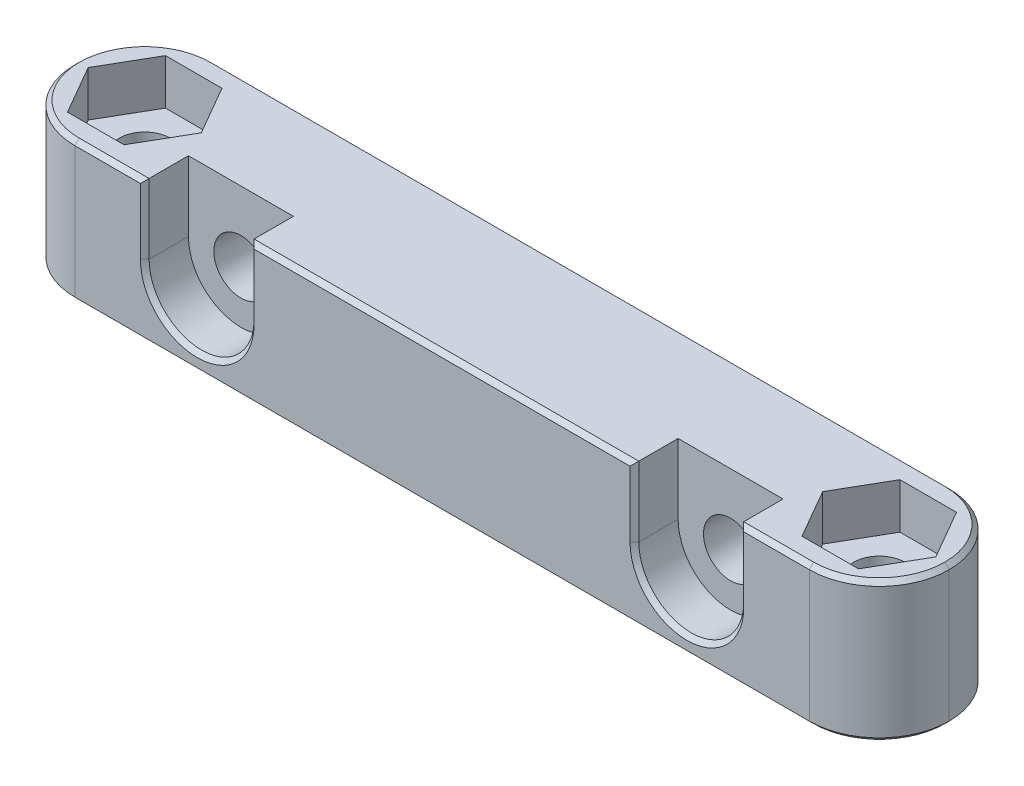
from build123d import *

# Parameters (mm, degrees)
DODANIE_WYCI_GNI_CIE1_DEPTH      = 4
DODANIE_WYCI_GNI_CIE1_DEPTH_BACK = 4
SZKIC1_W                         = 50
SZKIC1_H                         = 8
SZKIC1_R                         = 1.55
SZKIC2_R                         = 1.45
WYTNIJ_WYCI_GNI_CIE1_DEPTH       = 27.551836095
WYTNIJ_WYCI_GNI_CIE2_DEPTH       = 2.6
SZKIC4_R                         = 3
WYTNIJ_WYCI_GNI_CIE3_DEPTH       = 2.5
ZAOKR_GLENIE1_R                  = 4
SZKIC5_W                         = 6
SZKIC5_H                         = 4
WYTNIJ_WYCI_GNI_CIE4_DEPTH       = 2.5
SFAZOWANIE1_SIZE                 = 0.25


with BuildPart() as part:
    # Szkic1 → Dodanie-wyciągnięcie1 (new, two sides: drawn at the far end of the back side and taken through both)
    with BuildSketch(Plane.XY.offset(-DODANIE_WYCI_GNI_CIE1_DEPTH_BACK)):
        Rectangle(SZKIC1_W, SZKIC1_H)
        with Locations((-14, 0)):
            Circle(SZKIC1_R, mode=Mode.SUBTRACT)
        with Locations((14, 0)):
            Circle(SZKIC1_R, mode=Mode.SUBTRACT)
    extrude(amount=DODANIE_WYCI_GNI_CIE1_DEPTH + DODANIE_WYCI_GNI_CIE1_DEPTH_BACK)

    # Szkic2 → Wytnij-wyciągnięcie1 (cut, through all)
    with BuildSketch(Plane(origin=(0, 4, 0), x_dir=(1, 0, 0), z_dir=(0, 1, 0))):
        with Locations(Location((-21, 0, 0), (0, 0, 270))):
            Circle(SZKIC2_R)
        with Locations(Location((21, 0, 0), (0, 0, 270))):
            Circle(SZKIC2_R)
    extrude(amount=-WYTNIJ_WYCI_GNI_CIE1_DEPTH, mode=Mode.SUBTRACT)

    # Szkic3 → Wytnij-wyciągnięcie2 (cut)
    with BuildSketch(Plane(origin=(0, 4, 0), x_dir=(1, 0, 0), z_dir=(0, 1, 0))):
        Polygon((-17.766838493, 0), (-19.383419246, 2.8), (-22.616580754, 2.8), (-24.233161507, 0), (-22.616580754, -2.8), (-19.383419246, -2.8), align=None)
        Polygon((19.383419246, -2.8), (17.766838493, 0), (19.383419246, 2.8), (22.616580754, 2.8), (24.233161507, 0), (22.616580754, -2.8), align=None)
    extrude(amount=-WYTNIJ_WYCI_GNI_CIE2_DEPTH, mode=Mode.SUBTRACT)

    # Szkic4 → Wytnij-wyciągnięcie3 (cut)
    with BuildSketch(Plane.XY.offset(4)):
        with Locations((-14, 0)):
            Circle(SZKIC4_R)
        with Locations((14, 0)):
            Circle(SZKIC4_R)
    extrude(amount=-WYTNIJ_WYCI_GNI_CIE3_DEPTH, mode=Mode.SUBTRACT)

    # Zaokrąglenie1
    zaokr_glenie1_edges = [part.edges().sort_by_distance(p)[0] for p in [
        (25, 0, -4),
        (25, 0, 4),
        (-25, 0, 4),
        (-25, 0, -4),
    ]]
    fillet(zaokr_glenie1_edges, radius=ZAOKR_GLENIE1_R - 0.0001)  # a hair under: the kernel refuses the full size

    # Szkic5 → Wytnij-wyciągnięcie4 (cut)
    with BuildSketch(Plane.XY.offset(4)):
        with Locations((-14, 2)):
            Rectangle(SZKIC5_W, SZKIC5_H)
        with Locations((14, 2)):
            Rectangle(SZKIC5_W, SZKIC5_H)
    extrude(amount=-WYTNIJ_WYCI_GNI_CIE4_DEPTH, mode=Mode.SUBTRACT)

    # Sfazowanie1
    sfazowanie1_edges = [part.edges().sort_by_distance(p)[0] for p in [
        (19.00005, 4, 4),
        (0, 4, -4),
        (-23.828456414, 4, -2.828456414),
        (-23.828456414, 4, 2.828456414),
        (23.828456414, 4, 2.828456414),
        (23.828456414, 4, -2.828456414),
        (0, -4, -4),
        (0, -4, 4),
        (-23.828456414, -4, -2.828456414),
        (-23.828456414, -4, 2.828456414),
        (23.828456414, -4, 2.828456414),
        (23.828456414, -4, -2.828456414),
        (-14, -3, 4),
        (-15.55, 0, -4),
        (14, -3, 4),
        (0, 4, 4),
        (-19.00005, 4, 4),
        (-11, 2, 4),
        (-17, 2, 4),
        (17, 2, 4),
        (11, 2, 4),
        (12.45, 0, -4),
    ]]
    chamfer(sfazowanie1_edges, length=SFAZOWANIE1_SIZE)


solid = part.part
